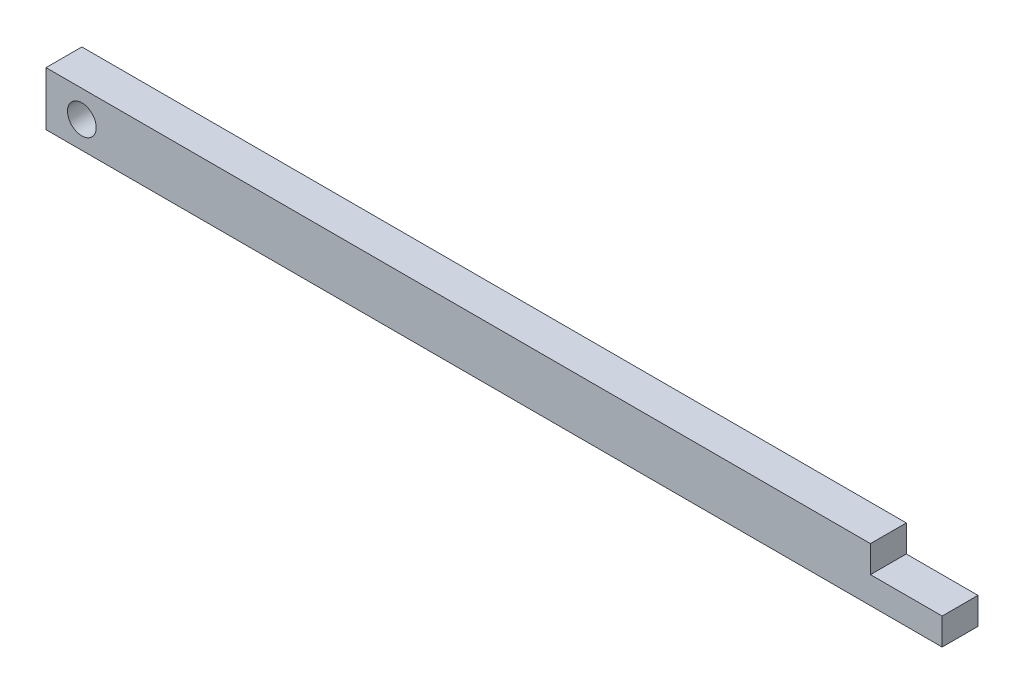
from build123d import *

# Parameters (mm, degrees)
BOSS_EXTRUDE1_DEPTH = 10
SKETCH3_R           = 4
CUT_EXTRUDE1_DEPTH  = 10


with BuildPart() as part:
    # Sketch1 → Boss-Extrude1 (new body)
    with BuildSketch(Plane.XY):
        Polygon((250, 7.5), (230, 7.5), (230, 15), (0, 15), (0, 0), (250, 0), align=None)
    extrude(amount=BOSS_EXTRUDE1_DEPTH)

    # Sketch3 → Cut-Extrude1 (cut)
    with BuildSketch(Plane.XY.offset(10)):
        with Locations((10, 7.5)):
            Circle(SKETCH3_R)
    extrude(amount=-CUT_EXTRUDE1_DEPTH, mode=Mode.SUBTRACT)


solid = part.part
